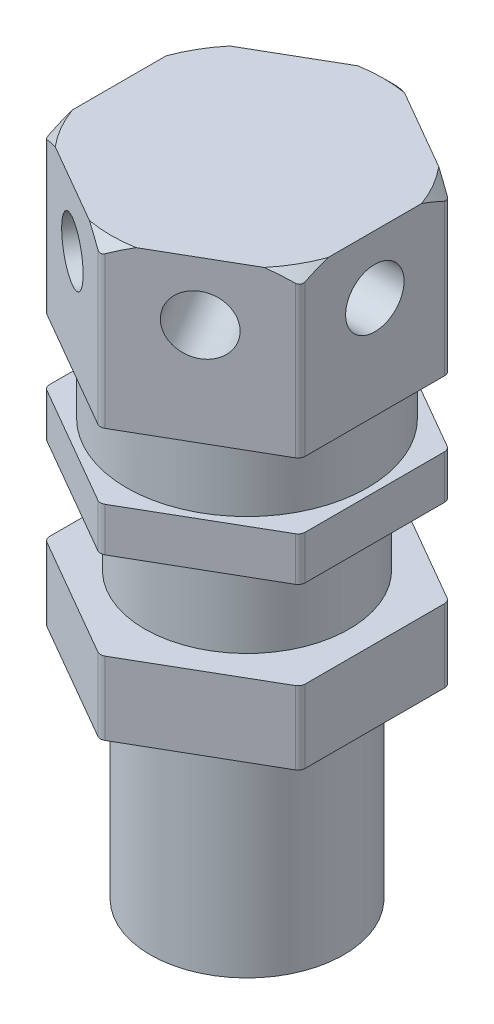
from build123d import *

# Parameters (mm, degrees)
EXTRUDE1_DEPTH     = 11
SKETCH2_R          = 8.25
EXTRUDE2_DEPTH     = 4.5
EXTRUDE3_DEPTH     = 3
SKETCH4_R          = 7
EXTRUDE4_DEPTH     = 6
EXTRUDE5_DEPTH     = 5
SKETCH6_R          = 6.625
EXTRUDE6_DEPTH     = 14.5
HOLE1_START        = -8.75
HOLE1_OUTLINE_R    = 2
HOLE1_DEPTH        = 17.5
CIRPATTERN1_COUNT  = 6
HOLE2_START        = -44
HOLE2_OUTLINE_R    = 2.5
HOLE2_DEPTH        = 38.438751133
SKETCH11_OUTSIDE_W = 123.768
SKETCH11_OUTSIDE_H = 126.476
SKETCH11_OUTSIDE_R = 9.3192
EXTRUDE8_DEPTH     = 46.985278556
EXTRUDE8_DRAFT     = -45
FILLET1_R          = 0.5


# Read off the part's stored shape, not the designer's step: Hole1, Hole2
with BuildPart() as part:
    # Sketch1 → Extrude1 (new body)
    with BuildSketch(Plane(origin=(0, 0, 0), x_dir=(1, 0, 0), z_dir=(0, 1, 0))):
        Polygon((0, 10.103629711), (-8.75, 5.051814855), (-8.75, -5.051814855), (0, -10.103629711), (8.75, -5.051814855), (8.75, 5.051814855), align=None)
    extrude(amount=-EXTRUDE1_DEPTH)

    # Sketch2 → Extrude2 (add)
    with BuildSketch(Plane.XZ.offset(11)):
        with Locations(Location((0, 0, 0), (0, 0, 90))):
            Circle(SKETCH2_R)
    extrude(amount=EXTRUDE2_DEPTH)

    # Sketch3 → Extrude3 (add)
    with BuildSketch(Plane.XZ.offset(15.5)):
        Polygon((0, -10.103629711), (8.75, -5.051814855), (8.75, 5.051814855), (0, 10.103629711), (-8.75, 5.051814855), (-8.75, -5.051814855), align=None)
    extrude(amount=EXTRUDE3_DEPTH)

    # Sketch4 → Extrude4 (add)
    with BuildSketch(Plane.XZ.offset(18.5)):
        with Locations(Location((0, 0, 0), (0, 0, 270))):
            Circle(SKETCH4_R)
    extrude(amount=EXTRUDE4_DEPTH)

    # Sketch5 → Extrude5 (add)
    with BuildSketch(Plane.XZ.offset(24.5)):
        Polygon((-8.75, -5.051814855), (0, -10.103629711), (8.75, -5.051814855), (8.75, 5.051814855), (0, 10.103629711), (-8.75, 5.051814855), align=None)
    extrude(amount=EXTRUDE5_DEPTH)

    # Sketch6 → Extrude6 (add)
    with BuildSketch(Plane.XZ.offset(29.5)):
        with Locations(Location((0, 0, 0), (0, 0, 90))):
            Circle(SKETCH6_R)
    extrude(amount=EXTRUDE6_DEPTH)

    # Hole1 outline → Hole1 (cut)
    with BuildSketch(Plane.YZ.offset(HOLE1_START)):
        with Locations((-4, 0)):
            Circle(HOLE1_OUTLINE_R)
    hole1 = extrude(amount=HOLE1_DEPTH, mode=Mode.SUBTRACT)

    # CirPattern1: Hole1 ×6 about axis
    cirpattern1_axis = Axis((0, -15.5, 0), (0, 1, 0))
    for i in range(1, CIRPATTERN1_COUNT):
        add(hole1.rotate(cirpattern1_axis, i * 360 / CIRPATTERN1_COUNT), mode=Mode.SUBTRACT)

    # Hole2 outline → Hole2 (cut)
    with BuildSketch(Plane(origin=(0, 0, 0), x_dir=(1, 0, 0), z_dir=(0, 1, 0)).offset(HOLE2_START)):
        Circle(HOLE2_OUTLINE_R)
    extrude(amount=HOLE2_DEPTH, mode=Mode.SUBTRACT)


with BuildPart() as extrude8_tool:
    # Sketch11 outside → Extrude8 (with draft: the straight prism first)
    with BuildSketch(Plane(origin=(0, 0, 0), x_dir=(1, 0, 0), z_dir=(0, 1, 0))):
        Rectangle(SKETCH11_OUTSIDE_W, SKETCH11_OUTSIDE_H)
        Circle(SKETCH11_OUTSIDE_R, mode=Mode.SUBTRACT)
    extrude(amount=-EXTRUDE8_DEPTH)
    # Extrude8: the draft: its side faces are tilted about the plane it starts from
    extrude8_sides = [extrude8_tool.faces().sort_by_distance(p)[0] for p in [
        (0, -23.492639278, 63.238),
        (61.884, -23.492639278, 0),
        (0, -23.492639278, -63.238),
        (-61.884, -23.492639278, 0),
        (-9.3192, -23.492639278, 0),
    ]]
    draft(extrude8_sides, Plane(origin=(0, 0, 0), x_dir=(1, 0, 0), z_dir=(0, 1, 0)), EXTRUDE8_DRAFT)


with BuildPart() as part_1:
    add(part.part)

    # Extrude8: cut by extrude8_tool
    add(extrude8_tool.part, mode=Mode.SUBTRACT)

    # Fillet1
    fillet1_edges = [part_1.edges().sort_by_distance(p)[0] for p in [
        (-8.75, -27, -5.051814855),
        (-8.75, -17, -5.051814855),
        (-8.75, -27, 5.051814855),
        (-8.75, -17, 5.051814855),
        (0, -27, 10.103629711),
        (0, -17, 10.103629711),
        (0, -5.892214855, 10.103629711),
        (8.75, -27, 5.051814855),
        (8.75, -27, -5.051814855),
        (0, -27, -10.103629711),
        (0, -17, -10.103629711),
        (8.75, -17, -5.051814855),
        (8.75, -17, 5.051814855),
        (8.75, -5.892214855, 5.051814855),
        (8.75, -5.892214855, -5.051814855),
        (0, -5.892214855, -10.103629711),
        (-8.75, -5.892214855, -5.051814855),
        (-8.75, -5.892214855, 5.051814855),
    ]]
    fillet(fillet1_edges, radius=FILLET1_R)


solid = part_1.part
